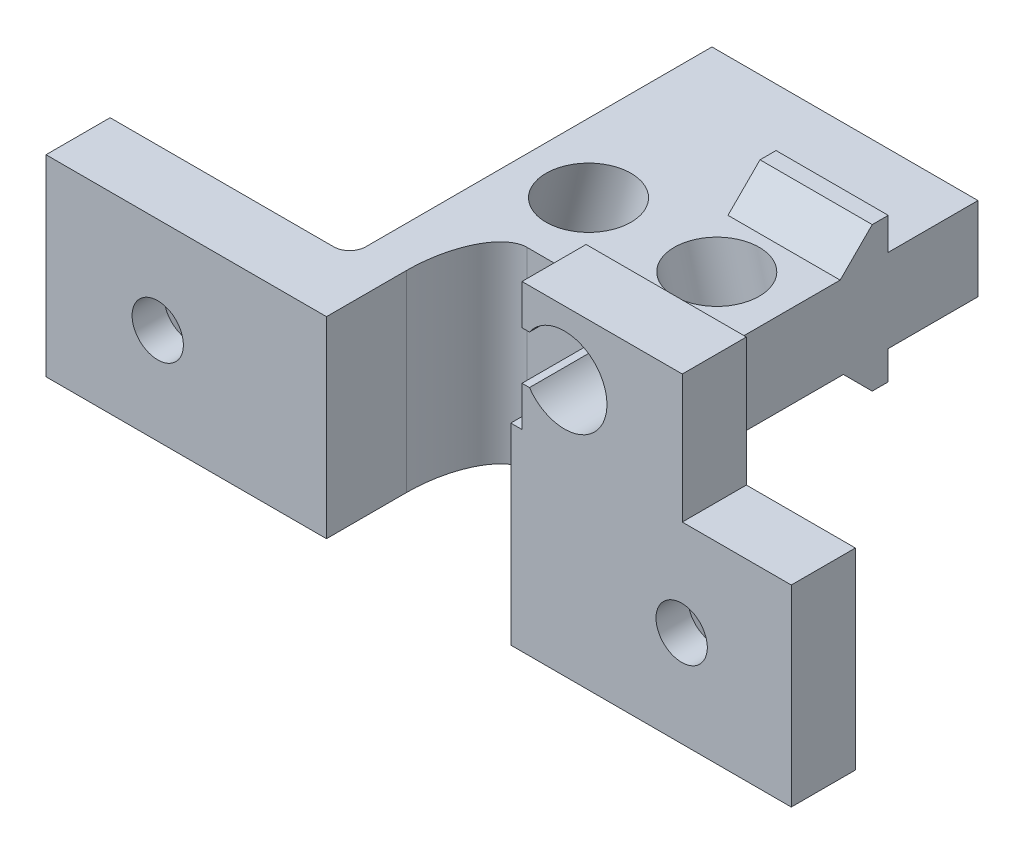
from build123d import *

# Parameters (mm, degrees)
BOSS_EXTRUDE1_DEPTH      = 12
CUT_EXTRUDE1_DEPTH       = 2
SKETCH3_W                = 16.6
SKETCH3_H                = 15
BOSS_EXTRUDE2_DEPTH      = 5.2
SKETCH5_R                = 1.6
CUT_EXTRUDE2_DEPTH       = 5
SKETCH6_W                = 10
SKETCH6_H                = 4
BOSS_EXTRUDE4_DEPTH      = 8
CUT_EXTRUDE4_DEPTH       = 7
SKETCH8_R                = 2.65
CUT_EXTRUDE5_DEPTH       = 7
SKETCH10_R               = 2.65
CUT_EXTRUDE6_DEPTH       = 7
BOSS_EXTRUDE6_DEPTH      = 2
BOSS_EXTRUDE6_DEPTH_BACK = 7
SKETCH11_W               = 7
SKETCH11_H               = 3
CHAMFER2_SIZE            = 2


with BuildPart() as part:
    # Sketch1 → Boss-Extrude1 (new body)
    with BuildSketch(Plane(origin=(0, 0, 0), x_dir=(1, 0, 0), z_dir=(0, 1, 0))):
        with BuildLine():
            Line((-23.25, -5), (-5.749755012, -5))
            Line((-5.749755012, -5), (-5.749755012, 0))
            add(Edge.make_bspline(
                [(-3.25, 5), (-5.749755012, 5), (-5.749755012, 0)],
                knots=[0, 0, 0, 1.570796327, 1.570796327, 1.570796327], degree=2, weights=[1, 0.707106781, 1]))
            Line((-3.25, 5), (3.25, 5))
            add(Edge.make_bspline(
                [(5.748694825, 0), (5.748694825, 5), (3.25, 5)],
                knots=[4.71238898, 4.71238898, 4.71238898, 6.283185307, 6.283185307, 6.283185307], degree=2, weights=[1, 0.707106781, 1]))
            Line((5.748694825, 0), (5.748694825, -5))
            Line((5.748694825, -5), (23.25, -5))
            Line((23.25, -5), (23.25, -3))
            Line((23.25, -3), (23.25, -1))
            Line((23.25, -1), (9.3, -1))
            ThreePointArc((9.3, -1), (8.592893219, -0.707106781), (8.3, 0))
            Line((8.3, 0), (8.3, 6.6))
            Line((8.3, 6.6), (-8.3, 6.6))
            Line((-8.3, 6.6), (-8.3, 0))
            ThreePointArc((-8.3, 0), (-8.592893219, -0.707106781), (-9.3, -1))
            Line((-9.3, -1), (-23.25, -1))
            Line((-23.25, -1), (-23.25, -5))
        make_face()
    extrude(amount=BOSS_EXTRUDE1_DEPTH)

    # Sketch2 → Cut-Extrude1 (cut)
    with BuildSketch(Plane(origin=(0, 0, 1), x_dir=(-1, 0, 0), z_dir=(0, 0, -1))):
        Polygon((20.147177825, 6), (18.213054423, 9.35), (14.344807619, 9.35), (12.410684218, 6), (14.344807619, 2.65), (18.213054423, 2.65), align=None)
        Polygon((-12.542169585, 6), (-14.476292987, 9.35), (-18.34453979, 9.35), (-20.278663192, 6), (-18.34453979, 2.65), (-14.476292987, 2.65), align=None)
    extrude(amount=-CUT_EXTRUDE1_DEPTH, mode=Mode.SUBTRACT)

    # Sketch3 → Boss-Extrude2 (add)
    with BuildSketch(Plane(origin=(0, 12, 0), x_dir=(1, 0, 0), z_dir=(0, 1, 0))):
        with Locations((0, 14.1)):
            Rectangle(SKETCH3_W, SKETCH3_H)
    extrude(amount=-BOSS_EXTRUDE2_DEPTH)

    # Sketch5 → Cut-Extrude2 (cut)
    with BuildSketch(Plane(origin=(0, 0, 1), x_dir=(-1, 0, 0), z_dir=(0, 0, -1))):
        with Locations((-16.410416388, 6)):
            Circle(SKETCH5_R)
        with Locations((16.278931021, 6)):
            Circle(SKETCH5_R)
    extrude(amount=-CUT_EXTRUDE2_DEPTH, mode=Mode.SUBTRACT)

    # Sketch6 → Boss-Extrude4 (add)
    with BuildSketch(Plane(origin=(0, 12, 0), x_dir=(1, 0, 0), z_dir=(0, 1, 0))):
        with Locations((11.448694825, -3)):
            Rectangle(SKETCH6_W, SKETCH6_H)
    extrude(amount=BOSS_EXTRUDE4_DEPTH)

    # Sketch7 → Cut-Extrude4 (cut)
    with BuildSketch(Plane(origin=(0, 0, 1), x_dir=(-1, 0, 0), z_dir=(0, 0, -1))):
        with BuildLine():
            ThreePointArc((-6.448694825, 16), (-6.567716372, 16.785269427), (-6.914089597, 17.5))
            Line((-6.914089597, 17.5), (-7.999397269, 17.5))
            Line((-7.999397269, 17.5), (-7.999397269, 14.5))
            Line((-7.999397269, 14.5), (-6.914089597, 14.5))
            ThreePointArc((-6.914089597, 14.5), (-6.567716372, 15.214730573), (-6.448694825, 16))
        make_face()
        with BuildLine():
            Line((-7.999397269, 17.5), (-6.914089597, 17.5))
            ThreePointArc((-6.914089597, 17.5), (-11.748694825, 16), (-6.914089597, 14.5))
            Line((-6.914089597, 14.5), (-7.999397269, 14.5))
            Line((-7.999397269, 14.5), (-7.999397269, 17.5))
        make_face()
        with BuildLine():
            Line((-6.448694825, 14.5), (-6.448694825, 16))
            ThreePointArc((-6.448694825, 16), (-6.567716372, 15.214730573), (-6.914089597, 14.5))
            Line((-6.914089597, 14.5), (-6.448694825, 14.5))
        make_face()
        with BuildLine():
            Line((-6.448694825, 16), (-6.448694825, 17.5))
            Line((-6.448694825, 17.5), (-6.914089597, 17.5))
            ThreePointArc((-6.914089597, 17.5), (-6.567716372, 16.785269427), (-6.448694825, 16))
        make_face()
    extrude(amount=-CUT_EXTRUDE4_DEPTH, mode=Mode.SUBTRACT)

    # Sketch8 → Cut-Extrude5 (cut, along a direction that is not the sketch's normal)
    with BuildSketch(Plane(origin=(0, 12, 0), x_dir=(1, 0, 0), z_dir=(0, 1, 0))):
        with Locations((-4, 9.6)):
            Circle(SKETCH8_R)
    extrude(amount=-CUT_EXTRUDE5_DEPTH, dir=(0.2588190451025147, 0.96592582628907, -1.457918124587514e-13), mode=Mode.SUBTRACT)

    # Sketch10 → Cut-Extrude6 (cut, along a direction that is not the sketch's normal)
    with BuildSketch(Plane(origin=(0, 12, 0), x_dir=(1, 0, 0), z_dir=(0, 1, 0))):
        with Locations((4, 9.6)):
            Circle(SKETCH10_R)
    extrude(amount=-CUT_EXTRUDE6_DEPTH, dir=(-0.25881904510251447, 0.96592582628907, 0), mode=Mode.SUBTRACT)

    # Sketch11 → Boss-Extrude6 (add, two sides: drawn at the far end of the back side and taken through both)
    with BuildSketch(Plane(origin=(0, 12, 0), x_dir=(1, 0, 0), z_dir=(0, 1, 0)).offset(-BOSS_EXTRUDE6_DEPTH_BACK)):
        with Locations((4.8, 14.5)):
            Rectangle(SKETCH11_W, SKETCH11_H)
    extrude(amount=BOSS_EXTRUDE6_DEPTH + BOSS_EXTRUDE6_DEPTH_BACK)

    # Chamfer2
    # the kernel refuses this chamfer: 2 mm, written as the material it takes off along each edge
    with BuildSketch(Plane(origin=(13.443365976, 5, -13), x_dir=(0, 0.9996219169112968, 0.027495876610586487), z_dir=(-1, 0, 0))) as chamfer2_piece_1_section:
        Polygon((CHAMFER2_SIZE * 0.999621916911, CHAMFER2_SIZE * 0.0274958766106), (-CHAMFER2_SIZE * 0.0274958766106, CHAMFER2_SIZE * 0.999621916911), (0, 0), align=None)
    chamfer2_piece_1 = extrude(amount=17.286731952, mode=Mode.PRIVATE)
    chamfer2_piece_1 = split(chamfer2_piece_1, bisect_by=Plane(origin=(4.8, 6.8, -13.671801494), z_dir=(0, -1, 0)), keep=Keep.TOP, mode=Mode.PRIVATE)
    add(chamfer2_piece_1, mode=Mode.SUBTRACT)
    with BuildSketch(Plane(origin=(13.443365976, 14, -13), x_dir=(0, -0.9996219169112968, 0.027495876610586487), z_dir=(-1, 0, 0))) as chamfer2_piece_2_section:
        Polygon((CHAMFER2_SIZE * 0.999621916911, -CHAMFER2_SIZE * 0.0274958766106), (-CHAMFER2_SIZE * 0.0274958766106, -CHAMFER2_SIZE * 0.999621916911), (0, 0), align=None)
    chamfer2_piece_2 = extrude(amount=17.286731952, mode=Mode.PRIVATE)
    chamfer2_piece_2 = split(chamfer2_piece_2, bisect_by=Plane(origin=(4.8, 12, -13.660808309), z_dir=(0, 1, 0)), keep=Keep.TOP, mode=Mode.PRIVATE)
    add(chamfer2_piece_2, mode=Mode.SUBTRACT)


solid = part.part
